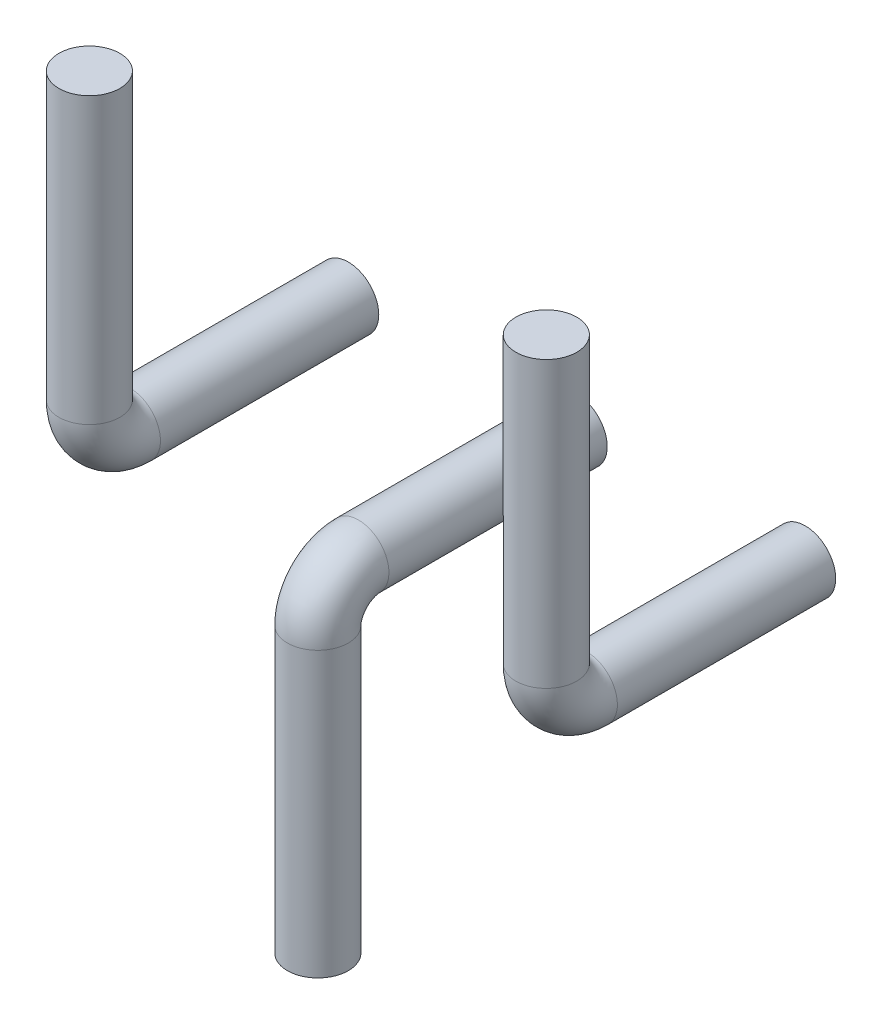
from build123d import *

# Parameters (mm, degrees)
SCHIZZO3_R = 3
SCHIZZO5_R = 3


with BuildPart() as part:
    # Sweep1: sweep along a path in Schizzo2
    with BuildLine(Plane(origin=(-55, -0.050815836, 0), x_dir=(0, 0, 1), z_dir=(-1, 0, 0))) as sweep1_path:
        Line((0, 0), (21.5, 0))
        ThreePointArc((21.5, 0), (24.328427125, 1.171572875), (25.5, 4))
        Line((25.5, 4), (25.5, 32.050815836))
    # Schizzo3 → Sweep1 (sweep)
    with BuildSketch(Plane.XY):
        with Locations((-55, -0.050815836)):
            Circle(SCHIZZO3_R)
        with Locations((-10, -0.050815836)):
            Circle(SCHIZZO3_R)
    sweep(path=sweep1_path.line)


with BuildPart() as body_2:
    # Sweep2: sweep along a path in Schizzo4
    with BuildLine(Plane(origin=(-32.5, -0.050815836, 0), x_dir=(0, 0, 1), z_dir=(-1, 0, 0))) as sweep2_path:
        Line((0, 0), (21.5, 0))
        ThreePointArc((21.5, 0), (24.328427125, -1.171572875), (25.5, -4))
        Line((25.5, -4), (25.5, -31.949184164))
    # Schizzo5 → Sweep2 (sweep)
    with BuildSketch(Plane.XY):
        with Locations((-32.5, -0.050815836)):
            Circle(SCHIZZO5_R)
    sweep(path=sweep2_path.line)


solid = Compound([part.part, body_2.part])
